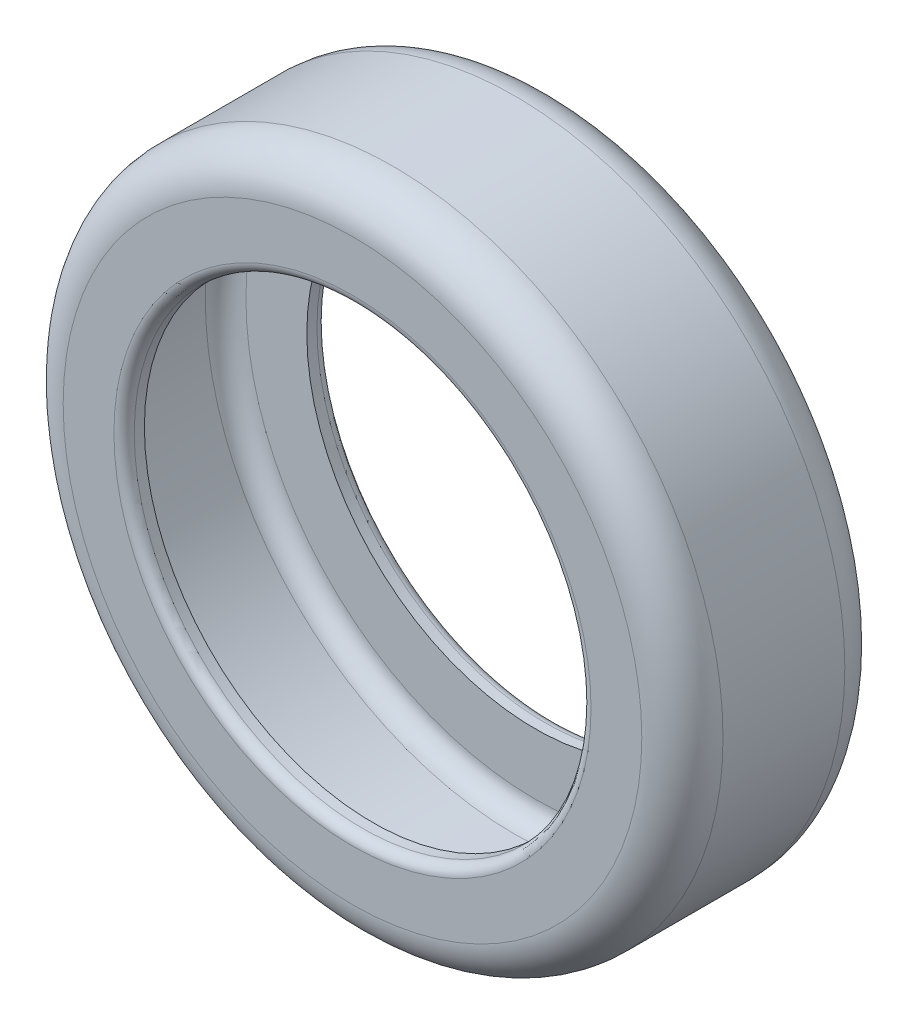
from build123d import *

# Parameters (mm, degrees)
SKETCH1_R           = 32.5
SKETCH1_R_2         = 22.5
EXTRUDE_THIN1_DEPTH = 20
FILLET1_R           = 4
FILLET2_R           = 1


# Read off the part's stored shape, not the designer's step: Shell1
with BuildPart() as part:
    # Sketch1 → Extrude-Thin1 (new body)
    with BuildSketch(Plane.XY):
        Circle(SKETCH1_R)
        Circle(SKETCH1_R_2, mode=Mode.SUBTRACT)
    extrude(amount=EXTRUDE_THIN1_DEPTH)

    # Fillet1
    fillet1_edges = [part.edges().sort_by_distance(p)[0] for p in [
        (-32.5, 0, 0),
        (-32.5, 0, 20),
    ]]
    fillet(fillet1_edges, radius=FILLET1_R)

    # Fillet2
    fillet2_edges = [part.edges().sort_by_distance(p)[0] for p in [
        (-22.5, 0, 0),
        (-22.5, 0, 20),
    ]]
    fillet(fillet2_edges, radius=FILLET2_R)

    # Shell1 outline → Shell1 (revolve, cut)
    with BuildSketch(Plane.XZ):
        with BuildLine():
            Line((28.5, 18), (22.5, 18))
            Line((22.5, 18), (22.5, 2))
            Line((22.5, 2), (28.5, 2))
            ThreePointArc((28.5, 2), (29.914213562, 2.585786438), (30.5, 4))
            Line((30.5, 4), (30.5, 16))
            ThreePointArc((30.5, 16), (29.914213562, 17.414213562), (28.5, 18))
        make_face()
    revolve(axis=Axis((0, 0, 0), (0, 0, 1)), mode=Mode.SUBTRACT)


solid = part.part
